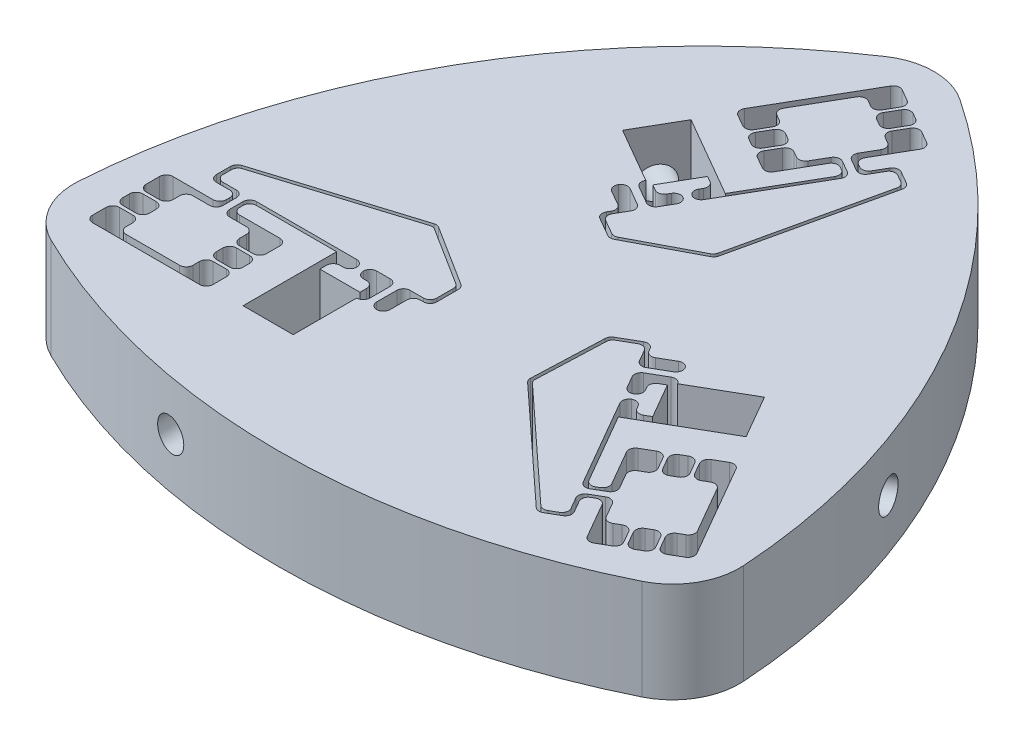
from build123d import *

# Parameters (mm, degrees)
DROP_THE_DEPTH            = 15
NOW_WE_DEPTH              = 78.83529619223752
FLEXY_FISH_R              = 1
FILLET_O_BASS_R           = 10
REFLEXURN_COUNT           = 3
FLEXY_FISH_OF_REFLEXURN_R = 1


with BuildPart() as part:
    # Bass → Drop the (new body)
    with BuildSketch(Plane(origin=(0, 0, 0), x_dir=(1, 0, 0), z_dir=(0, 1, 0))):
        with BuildLine():
            ThreePointArc((0, 57.73502691896249), (36.602540378444, 21.132486540518613), (50.0000000000002, -28.86751345948148))
            ThreePointArc((50.0000000000002, -28.86751345948148), (1.8376e-13, -42.264973081037496), (-49.999999999999794, -28.86751345948148))
            ThreePointArc((-49.999999999999794, -28.86751345948148), (-36.60254037844369, 21.132486540518478), (0, 57.73502691896249))
        make_face()
    extrude(amount=-DROP_THE_DEPTH)

    # Flexin → Now we (cut, through all)
    with BuildSketch(Plane.XZ):
        Polygon((-4.4019237886466955, -37.57477288111811), (-6.401923788646699, -34.110671265980336), (-9.866025403784457, -36.110671265980336), (-0.8660254037844322, -51.69912853410027), (2.598076211353324, -49.69912853410027), (0.5980762113533099, -46.2350269189625), (-2.0000000000000067, -47.7350269189625), (-7.00000000000001, -39.07477288111811), align=None)
        Polygon((3.031088913245547, -49.449128534100275), (5.629165124598845, -47.94912853410026), (3.629165124598843, -44.485026918962504), (1.0310889132455376, -45.985026918962504), align=None)
        Polygon((-9.455771365940002, -16.82125210353707), (-8.455771365940002, -18.55330291110596), (-4.125644347017807, -16.053302911105956), (-6.125644347017804, -12.589201295968198), (-2.661542731880046, -10.589201295968204), (7.284609690826583, -15.816442631920392), (12.47243186433552, -38.80201421707022), (9.874355652982207, -40.30201421707023), (7.874355652982125, -36.83791260193252), (4.410254037844367, -38.83791260193253), (6.660254037844379, -42.735026918962504), (4.062177826491067, -44.23502691896251), (6.062177826491069, -47.69912853410026), (9.52627944162883, -45.699128534100254), (5.526279441628815, -38.77092530382475), (7.691342951089957, -37.520925303824725), (9.691342951089954, -40.98502691896248), (13.041201253461109, -39.050985326341376), (7.721527013492432, -15.481219639910236), (-2.6728796894953852, -10.018396422309651), (-6.808657048909986, -12.40618859407603), (-5.558657048910018, -14.571252103537077), align=None)
        Polygon((-3.625644347017806, -16.9193283148904), (-7.9557713659400005, -19.419328314890393), (-7.455771365940006, -20.285353718674834), (-15.683012701892169, -25.03535371867485), (-11.933012701892165, -31.53054424705814), (0.19134295108997357, -24.530544247058128), (6.6913429510899505, -35.788874496255836), (4.526279441628809, -37.038874496255865), (0.5262794416288106, -30.11067126598034), (-2.937822173508954, -32.11067126598034), (-0.9378221735089524, -35.5747728811181), (1.660254037844369, -34.07477288111811), (3.910254037844367, -37.97188719814809), (7.3743556529821195, -35.97188719814808), (-1.1256443470178075, -21.2494553338126), (-2.857695154586688, -22.249455333812598), (-1.607695154586696, -24.414518843273697), (-3.339745962155571, -25.414518843273694), (-6.339745962155565, -20.218366420567058), (-4.607695154586685, -19.218366420567065), (-3.357695154586686, -21.383429930028154), (-1.6256443470178055, -20.38342993002816), align=None)
        Polygon((-1.3708348754011683, -35.82477288111811), (-3.3708348754011657, -32.36067126598035), (-5.968911086754485, -33.86067126598033), (-3.9689110867544746, -37.3247728811181), align=None)
    now_we = extrude(amount=NOW_WE_DEPTH, mode=Mode.SUBTRACT)

    # Sketch3 → 3/16 (0.1875) Diameter Hole1 (revolve, cut)
    with BuildSketch(Plane(origin=(-13.80801270189219, -7.5, -28.2829489828665), x_dir=(0.5000000000000004, 0, -0.8660254037844385), z_dir=(0, 1, 0))):
        Polygon((0, 0), (-1.082e-14, 44.157963466013086), (2.381249999999992, 44.157963466013086), (2.3812499999999996, -2e-17), align=None)
    f_3_16_0_1875_diameter_hole1 = revolve(axis=Axis((-8.308751387861014, -7.5, -25.107948982866503), (-0.8660254037844384, 0, -0.5000000000000003)), mode=Mode.SUBTRACT)

    # Flexy Fish
    flexy_fish_edges = [part.edges().sort_by_distance(p)[0] for p in [
        (4.410254037844367, -7.5, -38.83791260193253),
        (7.874355652982125, -7.5, -36.83791260193252),
        (7.691342951089957, -7.5, -37.520925303824725),
        (7.3743556529821195, -7.5, -35.97188719814808),
        (6.6913429510899505, -7.5, -35.788874496255836),
        (4.526279441628809, -7.5, -37.038874496255865),
        (3.910254037844367, -7.5, -37.97188719814809),
        (-2.6728796894953852, -7.5, -10.018396422309651),
        (-2.6615427318800458, -7.5, -10.589201295968204),
        (7.284609690826583, -7.5, -15.816442631920392),
        (7.721527013492432, -7.5, -15.481219639910236),
        (12.47243186433552, -7.5, -38.80201421707022),
        (13.041201253461109, -7.5, -39.050985326341376),
        (9.691342951089954, -7.5, -40.98502691896248),
        (9.874355652982207, -7.5, -40.30201421707023),
        (-7.9557713659400005, -7.5, -19.419328314890393),
        (-8.455771365940002, -7.5, -18.55330291110596),
        (-4.125644347017807, -7.5, -16.053302911105956),
        (-5.558657048910018, -7.5, -14.571252103537077),
        (-6.125644347017804, -7.5, -12.589201295968198),
        (-6.808657048909986, -7.5, -12.40618859407603),
        (-2.857695154586688, -7.5, -22.249455333812598),
        (-1.1256443470178075, -7.5, -21.2494553338126),
        (-1.6256443470178055, -7.5, -20.38342993002816),
        (-3.357695154586686, -7.5, -21.383429930028154),
        (-3.625644347017806, -7.5, -16.9193283148904),
        (3.6291651245988428, -7.5, -44.485026918962504),
        (4.062177826491067, -7.5, -44.23502691896251),
        (6.660254037844379, -7.5, -42.735026918962504),
        (-2.000000000000006, -7.5, -47.7350269189625),
        (1.0310889132455374, -7.5, -45.985026918962504),
        (1.660254037844369, -7.5, -34.07477288111811),
        (-0.9378221735089523, -7.5, -35.5747728811181),
        (-1.3708348754011683, -7.5, -35.82477288111811),
        (-3.9689110867544746, -7.5, -37.3247728811181),
        (-4.4019237886466955, -7.5, -37.57477288111811),
        (-7.00000000000001, -7.5, -39.07477288111811),
        (0.5980762113533098, -7.5, -46.2350269189625),
        (-4.607695154586685, -7.5, -19.218366420567065),
        (-1.607695154586696, -7.5, -24.414518843273697),
        (-9.866025403784457, -7.5, -36.110671265980336),
        (-6.401923788646699, -7.5, -34.110671265980336),
        (-5.968911086754485, -7.5, -33.86067126598033),
        (-3.3708348754011657, -7.5, -32.36067126598035),
        (-2.937822173508954, -7.5, -32.11067126598034),
        (0.5262794416288106, -7.5, -30.11067126598034),
        (5.526279441628815, -7.5, -38.77092530382475),
        (9.52627944162883, -7.5, -45.699128534100254),
        (6.062177826491069, -7.5, -47.69912853410026),
        (5.629165124598845, -7.5, -47.94912853410026),
        (2.598076211353324, -7.5, -49.69912853410027),
        (3.031088913245547, -7.5, -49.449128534100275),
        (-0.8660254037844323, -7.5, -51.69912853410027),
        (-9.455771365940002, -7.5, -16.82125210353707),
    ]]
    fillet(flexy_fish_edges, radius=FLEXY_FISH_R - 0.0001)  # a hair under: the kernel refuses the full size

    # Fillet o' Bass
    fillet_o_bass_edges = [part.edges().sort_by_distance(p)[0] for p in [
        (-49.999999999999794, -7.5, 28.86751345948149),
        (-1.066e-14, -7.5, -57.73502691896249),
        (50.0000000000002, -7.5, 28.867513459481472),
    ]]
    fillet(fillet_o_bass_edges, radius=FILLET_O_BASS_R)

    # Reflexurn: Now we, 3/16 (0.1875) Diameter Hole1 ×3 about axis
    reflexurn_axis = Axis((-3.2e-16, 0, -3.306e-14), (0, 1, 0))
    add([now_we.rotate(reflexurn_axis, i * 360 / REFLEXURN_COUNT) for i in range(1, REFLEXURN_COUNT)], mode=Mode.SUBTRACT)
    add([f_3_16_0_1875_diameter_hole1.rotate(reflexurn_axis, i * 360 / REFLEXURN_COUNT) for i in range(1, REFLEXURN_COUNT)], mode=Mode.SUBTRACT)

    # Flexy Fish of Reflexurn
    flexy_fish_of_reflexurn_edges = [part.edges().sort_by_distance(p)[0] for p in [
        (-35.83974596215552, -7.5, 15.59956426705009),
        (-35.83974596215551, -7.5, 11.599564267050082),
        (-36.33974596215552, -7.5, 12.099564267050031),
        (-34.839745962155504, -7.5, 11.599564267050086),
        (-34.339745962155504, -7.5, 12.09956426705003),
        (-34.339745962155504, -7.5, 14.599564267050082),
        (-34.83974596215551, -7.5, 15.599564267050088),
        (-7.339745962155571, -7.5, 7.323979923517239),
        (-7.839745962155515, -7.5, 7.599564267050004),
        (-17.33974596215553, -7.5, 1.5995642670500156),
        (-17.26789299647503, -7.5, 1.0535712702628304),
        (-39.839745962155504, -7.5, 8.599564267049985),
        (-40.339745962155504, -7.5, 8.231481081807846),
        (-40.33974596215552, -7.5, 12.09956426705003),
        (-39.83974596215551, -7.5, 11.599564267049985),
        (-12.839745962155511, -7.5, 16.599564267050006),
        (-11.839745962155513, -7.5, 16.599564267050013),
        (-11.83974596215551, -7.5, 11.599564267050008),
        (-9.839745962155511, -7.5, 12.09956426705),
        (-7.83974596215551, -7.5, 11.599564267050006),
        (-7.339745962155572, -7.5, 12.099564267049997),
        (-17.83974596215552, -7.5, 13.599564267050015),
        (-17.839745962155522, -7.5, 11.599564267050013),
        (-16.839745962155522, -7.5, 11.59956426705001),
        (-16.83974596215551, -7.5, 13.59956426705001),
        (-12.839745962155515, -7.5, 11.59956426705001),
        (-40.33974596215552, -7.5, 19.099564267050077),
        (-40.339745962155526, -7.5, 18.599564267050077),
        (-40.339745962155526, -7.5, 15.599564267050074),
        (-40.33974596215552, -7.5, 25.59956426705007),
        (-40.339745962155526, -7.5, 22.099564267050066),
        (-30.339745962155508, -7.5, 15.599564267050082),
        (-30.339745962155497, -7.5, 18.599564267050084),
        (-30.339745962155508, -7.5, 19.099564267050084),
        (-30.339745962155504, -7.5, 22.099564267050074),
        (-30.339745962155515, -7.5, 22.599564267050077),
        (-30.339745962155515, -7.5, 25.599564267050077),
        (-40.33974596215552, -7.5, 22.59956426705007),
        (-14.33974596215552, -7.5, 13.599564267050015),
        (-20.339745962155515, -7.5, 13.599564267050022),
        (-26.339745962155494, -7.5, 26.599564267050077),
        (-26.339745962155494, -7.5, 22.599564267050074),
        (-26.339745962155487, -7.5, 22.099564267050074),
        (-26.339745962155504, -7.5, 19.09956426705008),
        (-26.339745962155494, -7.5, 18.599564267050084),
        (-26.339745962155497, -7.5, 14.599564267050074),
        (-36.33974596215552, -7.5, 14.59956426705008),
        (-44.339745962155526, -7.5, 14.599564267050061),
        (-44.339745962155526, -7.5, 18.59956426705007),
        (-44.339745962155526, -7.5, 19.099564267050074),
        (-44.33974596215553, -7.5, 22.599564267050066),
        (-44.33974596215554, -7.5, 22.099564267050066),
        (-44.33974596215553, -7.5, 26.599564267050066),
        (-9.839745962155503, -7.5, 16.599564267050006),
        (31.429491924311137, -7.5, 23.23834833488235),
        (27.96539030917337, -7.5, 25.23834833488235),
        (28.648403011065547, -7.5, 25.421361036774606),
        (27.465390309173372, -7.5, 24.3723229310979),
        (27.648403011065543, -7.5, 23.689310229205713),
        (29.81346652052669, -7.5, 22.43931022920569),
        (30.92949192431113, -7.5, 22.372322931097912),
        (10.012625651650955, -7.5, 2.6944164987923154),
        (10.501288694035557, -7.5, 2.989637028918103),
        (10.05513627132894, -7.5, 14.216878364870277),
        (9.546365982982593, -7.5, 14.427648369647308),
        (27.367314097819964, -7.5, 30.202449950020146),
        (27.29854470869438, -7.5, 30.819504244533437),
        (30.648403011065547, -7.5, 28.885462651912356),
        (29.965390309173287, -7.5, 28.70244995002015),
        (20.795517328095507, -7.5, 2.819764047840294),
        (20.29551732809551, -7.5, 1.9537386440558566),
        (15.965390309173312, -7.5, 4.4537386440558535),
        (15.398403011065527, -7.5, 2.4716878364869825),
        (13.965390309173312, -7.5, 0.9896370289180987),
        (14.148403011065556, -7.5, 0.30662432702593767),
        (20.6974411167422, -7.5, 8.64989106676249),
        (18.965390309173323, -7.5, 9.649891066762493),
        (18.46539030917332, -7.5, 8.783865662978055),
        (20.19744111674219, -7.5, 7.783865662978049),
        (16.465390309173316, -7.5, 5.319764047840295),
        (36.71058083755666, -7.5, 25.385462651912338),
        (36.277568135664445, -7.5, 25.635462651912345),
        (33.67949192431113, -7.5, 27.135462651912334),
        (42.33974596215551, -7.5, 22.135462651912338),
        (39.30865704890997, -7.5, 23.88546265191235),
        (28.679491924311126, -7.5, 18.47520861406793),
        (31.277568135664442, -7.5, 16.975208614067924),
        (31.710580837556666, -7.5, 16.72520861406793),
        (34.308657048909964, -7.5, 15.22520861406794),
        (34.741669750802195, -7.5, 14.975208614067942),
        (37.33974596215551, -7.5, 13.475208614067945),
        (39.74166975080219, -7.5, 23.635462651912338),
        (18.947441116742198, -7.5, 5.618802153516958),
        (21.947441116742205, -7.5, 10.814954576223581),
        (36.20577136593994, -7.5, 9.511106998930176),
        (32.74166975080218, -7.5, 11.511106998930174),
        (32.308657048909964, -7.5, 11.761106998930167),
        (29.710580837556662, -7.5, 13.261106998930178),
        (29.27756813566444, -7.5, 13.511106998930167),
        (25.813466520526678, -7.5, 15.511106998930174),
        (30.813466520526685, -7.5, 24.171361036774577),
        (34.813466520526674, -7.5, 31.0995642670501),
        (38.27756813566444, -7.5, 29.0995642670501),
        (38.710580837556655, -7.5, 28.849564267050095),
        (41.741669750802195, -7.5, 27.099564267050113),
        (41.30865704890998, -7.5, 27.34956426705012),
        (45.20577136593995, -7.5, 25.099564267050113),
        (19.295517328095503, -7.5, 0.22168783648697185),
    ]]
    fillet(flexy_fish_of_reflexurn_edges, radius=FLEXY_FISH_OF_REFLEXURN_R - 0.0001)  # a hair under: the kernel refuses the full size


solid = part.part
